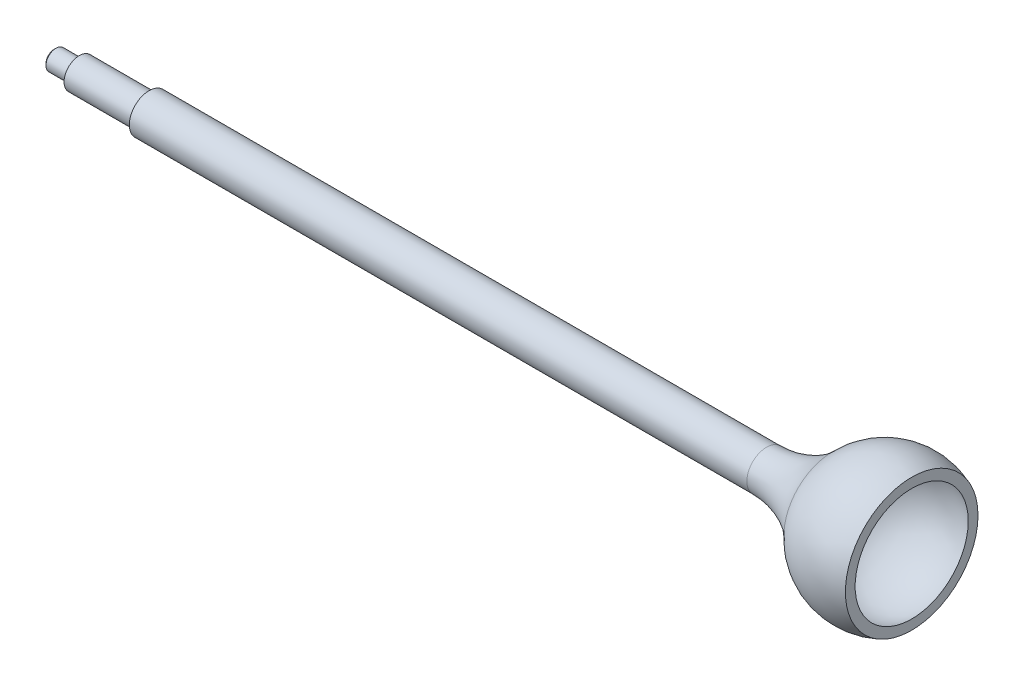
from build123d import *

# Parameters (mm, degrees)
CHAMFER1_SIZE = 1


with BuildPart() as part:
    # Sketch1 → Revolve1 (revolve)
    with BuildSketch(Plane.XY, mode=Mode.PRIVATE) as revolve1_sk:
        Polygon((-39, 8.5), (-39, 5.6), (-53, 5.6), (-53, 0), (411.5, 0), (411.5, 11), (0, 11), (0, 8.5), align=None)
    revolve(revolve1_sk.sketch.rotate(Axis((-53, 0, 0), (1, 0, 0)), 90), axis=Axis((-53, 0, 0), (1, 0, 0)))

    # Chamfer1
    chamfer1_edges = [part.edges().sort_by_distance(p)[0] for p in [
        (-53, 0, -5.6),
    ]]
    chamfer(chamfer1_edges, length=CHAMFER1_SIZE)

    # Sketch2 → Revolve2 (revolve)
    with BuildSketch(Plane(origin=(0, 0, 0), x_dir=(1, 0, 0), z_dir=(0, 1, 0))):
        with BuildLine():
            Line((371.5, 0), (451.5, 0))
            ThreePointArc((451.5, 0), (411.5, 40), (371.5, 0))
        make_face()
    revolve(axis=Axis((371.5, 0, 0), (1, 0, 0)))

    # Fillet1: read off the stored shape, not the designer's step
    # Fillet1 outline → Fillet1 (revolve)
    with BuildSketch(Plane.YX):
        with BuildLine():
            ThreePointArc((11, 345.325986974), (15.20456112, 365.395311272), (27.111111111, 382.089327544))
            Line((27.111111111, 382.089327544), (11, 382.089327544))
            Line((11, 382.089327544), (11, 345.325986974))
        make_face()
    revolve(axis=Axis((0, 0, 0), (1, 0, 0)))

    # Sketch3 → Cut-Revolve1 (revolve, cut)
    with BuildSketch(Plane(origin=(0, 0, 0), x_dir=(1, 0, 0), z_dir=(0, 1, 0))):
        with BuildLine():
            Line((426.5, 0), (451.5, 0))
            ThreePointArc((451.5, 0), (444.666247904, 22.360679775), (426.5, 37.080992435))
            Line((426.5, 37.080992435), (426.5, 0))
        make_face()
    revolve(axis=Axis((426.5, 0, 0), (1, 0, 0)), mode=Mode.SUBTRACT)

    # Sketch4 → Cut-Revolve2 (revolve, cut)
    with BuildSketch(Plane(origin=(0, 0, 0), x_dir=(1, 0, 0), z_dir=(0, 1, 0))):
        with BuildLine():
            Line((376.5, 0), (446.5, 0))
            ThreePointArc((446.5, 0), (411.5, 35), (376.5, 0))
        make_face()
    revolve(axis=Axis((376.5, 0, 0), (1, 0, 0)), mode=Mode.SUBTRACT)


solid = part.part
